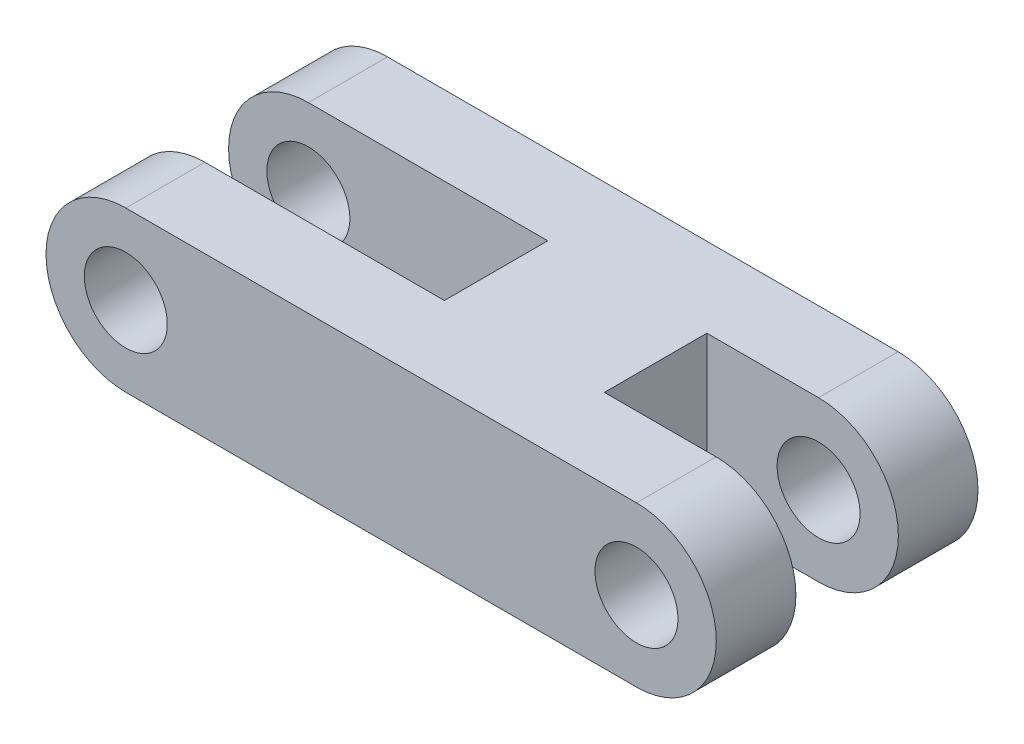
from build123d import *

# Parameters (mm, degrees)
SKETCH1_R           = 1.651
BOSS_EXTRUDE1_DEPTH = 10.414
SKETCH2_W           = 12.7
SKETCH2_H           = 4.1148
SKETCH2_H_2         = 4.0767
CUT_EXTRUDE1_DEPTH  = 76.347699699


with BuildPart() as part:
    # Sketch1 → Boss-Extrude1 (new body)
    with BuildSketch(Plane.XY):
        with BuildLine():
            Line((-71.178896696, 3.175), (-50.858896696, 3.175))
            ThreePointArc((-50.858896696, 3.175), (-47.683896696, 0), (-50.858896696, -3.175))
            Line((-50.858896696, -3.175), (-71.178896696, -3.175))
            ThreePointArc((-71.178896696, -3.175), (-74.353896696, 0), (-71.178896696, 3.175))
        make_face()
        with Locations((-50.858896696, 0)):
            Circle(SKETCH1_R, mode=Mode.SUBTRACT)
        with Locations((-71.178896696, 0)):
            Circle(SKETCH1_R, mode=Mode.SUBTRACT)
    extrude(amount=BOSS_EXTRUDE1_DEPTH)

    # Sketch2 → Cut-Extrude1 (cut, through all)
    with BuildSketch(Plane(origin=(0, 3.175, 0), x_dir=(1, 0, 0), z_dir=(0, 1, 0))):
        with Locations((-68.003896696, -5.207)):
            Rectangle(SKETCH2_W, SKETCH2_H)
        with Locations((-48.953896696, -5.207)):
            Rectangle(SKETCH2_W, SKETCH2_H_2)
    extrude(amount=-CUT_EXTRUDE1_DEPTH, mode=Mode.SUBTRACT)


solid = part.part
